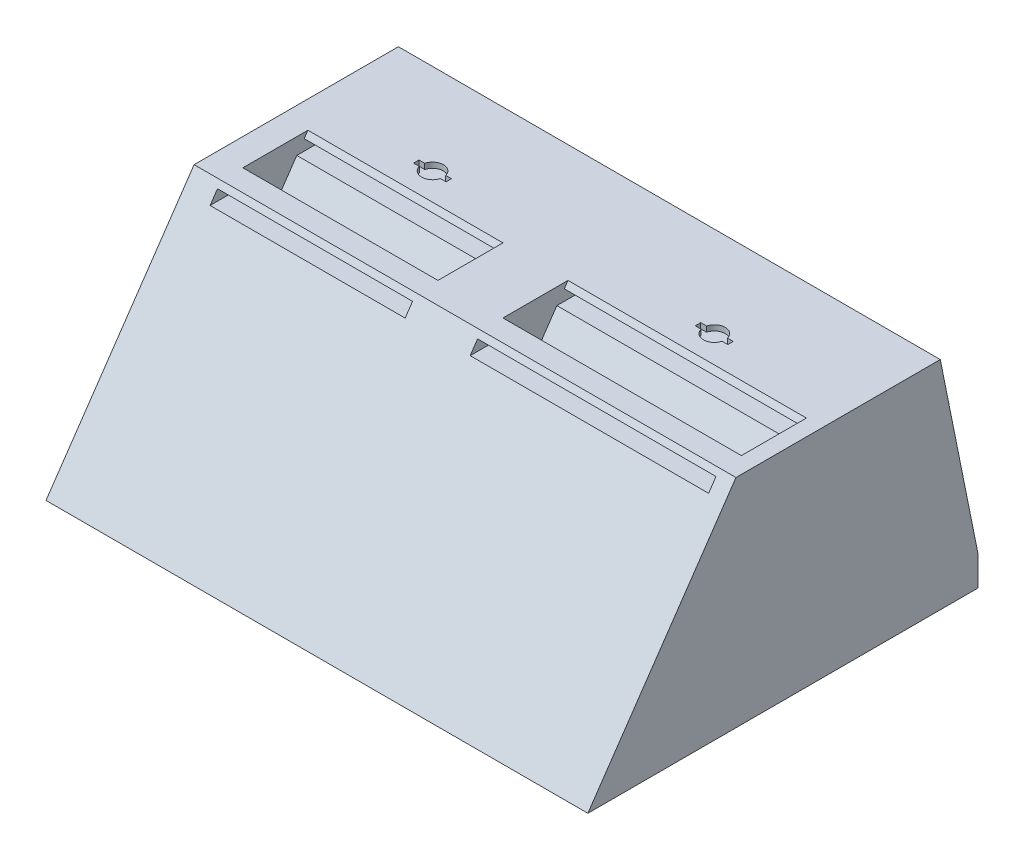
from build123d import *

# Parameters (mm, degrees)
SKIZZE1_W                            = 50
SKIZZE1_H                            = 30
AUFSATZ_LINEAR_AUSTRAGEN1_DEPTH      = 40
FPV_SENDER_START                     = -1.5
FPV_SENDER_DEPTH                     = 22
EMPF_NGER_START                      = 4.5
EMPF_NGER_DEPTH                      = 18
SCHNITT_LINEAR_AUSTRAGEN3_DEPTH      = 66.76473219
SCHNITT_LINEAR_AUSTRAGEN3_DEPTH_BACK = 66.76473219
SCHNITT_LINEAR_AUSTRAGEN5_REACH      = 65.411
WANDUNG2_START                       = -23
WANDUNG2_DEPTH                       = 46
WANDUNG2_START_2                     = -2.5
WANDUNG2_2_DEPTH                     = 2
SKIZZE6_W                            = 7
SKIZZE6_H                            = 6
SCHNITT_LINEAR_AUSTRAGEN4_DEPTH      = 2
SKIZZE8_W                            = 4
SKIZZE8_H                            = 6
SCHNITT_LINEAR_AUSTRAGEN7_DEPTH      = 2
SCHNITT_LINEAR_START                 = -2.5
SCHNITT_LINEAR_AUSTRAGEN8_DEPTH      = 18
SCHNITT_LINEAR_START_2               = -1.5
SCHNITT_LINEAR_AUSTRAGEN9_DEPTH      = 22
AUFSATZ_LINEAR_AUSTRAGEN2_REACH      = 63.847
SCHNITT_LINEAR_AUSTRAGEN10_REACH     = 50.177
SKIZZE11_R                           = 1
SKIZZE11_W                           = 3
SKIZZE11_H                           = 0.5


# Read off the part's stored shape, not the designer's step: Wandung2
with BuildPart() as part:
    # Skizze1 → Aufsatz-Linear austragen1 (new body)
    with BuildSketch(Plane.XY):
        Rectangle(SKIZZE1_W, SKIZZE1_H)
    extrude(amount=AUFSATZ_LINEAR_AUSTRAGEN1_DEPTH)

    # Skizze2 → FPV_Sender (cut)
    with BuildSketch(Plane.ZY.offset(FPV_SENDER_START)):
        Polygon((13.5, 15), (7.5, 15), (26.633333333, -13), (32.633333333, -13), align=None)
    extrude(amount=-FPV_SENDER_DEPTH, mode=Mode.SUBTRACT)

    # Skizze4 → Empfänger (cut)
    with BuildSketch(Plane.ZY.offset(EMPF_NGER_START)):
        Polygon((13.5, 15), (7.5, 15), (26.633333333, -13), (32.633333333, -13), align=None)
    extrude(amount=EMPF_NGER_DEPTH, mode=Mode.SUBTRACT)

    # Skizze5 → Schnitt-Linear austragen3 (cut, two sides: drawn at the far end of the back side and taken through both)
    with BuildSketch(Plane.ZY.offset(25).offset(-SCHNITT_LINEAR_AUSTRAGEN3_DEPTH_BACK)):
        Polygon((15.5, 15), (40, 15), (40, -20.853658537), align=None)
        Polygon((5.5, 15), (0, -12.25), (0, 15), align=None)
    extrude(amount=SCHNITT_LINEAR_AUSTRAGEN3_DEPTH + SCHNITT_LINEAR_AUSTRAGEN3_DEPTH_BACK, mode=Mode.SUBTRACT)

    # Schnitt-Linear austragen5: up to this face of the body (flat: up to its plane)
    schnitt_linear_austragen5_end = Plane(part.part.faces().sort_by_distance((-25, -2.83971717, 14.814249022))[0])
    # Skizze7 → Schnitt-Linear austragen5 (cut, up to the picked face)
    with BuildSketch(Plane(origin=(25, 0, 0), x_dir=(0, 0, -1), z_dir=(1, 0, 0)), mode=Mode.PRIVATE) as schnitt_linear_austragen5_sk1:
        Polygon((-5.5, 15), (-15.5, 15), (-22.333333333, 5), (-3.481651376, 5), align=None)
    schnitt_linear_austragen5_tool1 = split(extrude(schnitt_linear_austragen5_sk1.sketch, amount=-SCHNITT_LINEAR_AUSTRAGEN5_REACH, mode=Mode.PRIVATE), bisect_by=schnitt_linear_austragen5_end, keep=Keep.BOTH, mode=Mode.PRIVATE)
    add(schnitt_linear_austragen5_tool1.solids().sort_by(Axis((25, 9.488667, 11.826849), (-1, 0, 0)))[0], mode=Mode.SUBTRACT)

    # Wandung2 outline → Wandung2 (cut)
    with BuildSketch(Plane.YZ.offset(WANDUNG2_START)):
        Polygon((3, 13.27765036), (-15, 25.57765036), (-15, 2), (-12.449820142, 2), (3, 5.118312322), align=None)
    extrude(amount=WANDUNG2_DEPTH, mode=Mode.SUBTRACT)

    # Wandung2 2 outline → Wandung2 2 (cut)
    with BuildSketch(Plane.YZ.offset(WANDUNG2_START_2)):
        Polygon((-15, 33.57765036), (-15, 25.57765036), (3, 13.27765036), (3, 21.27765036), align=None)
    extrude(amount=WANDUNG2_2_DEPTH, mode=Mode.SUBTRACT)

    # Skizze6 → Schnitt-Linear austragen4 (cut)
    with BuildSketch(Plane(origin=(0, -13, 0), x_dir=(1, 0, 0), z_dir=(0, 1, 0))):
        with Locations((5, -29.633333333)):
            Rectangle(SKIZZE6_W, SKIZZE6_H)
    extrude(amount=-SCHNITT_LINEAR_AUSTRAGEN4_DEPTH, mode=Mode.SUBTRACT)

    # Skizze8 → Schnitt-Linear austragen7 (cut)
    with BuildSketch(Plane(origin=(0, -13, 0), x_dir=(1, 0, 0), z_dir=(0, 1, 0))):
        with Locations((-6.5, -29.633333333)):
            Rectangle(SKIZZE8_W, SKIZZE8_H)
    extrude(amount=-SCHNITT_LINEAR_AUSTRAGEN7_DEPTH, mode=Mode.SUBTRACT)

    # Skizze9 → Schnitt-Linear austragen8 (cut)
    with BuildSketch(Plane.ZY.offset(25).offset(SCHNITT_LINEAR_START)):
        Polygon((22.675, 4.5), (7.675, 4.5), (7.675, 3.5), (23.358333333, 3.5), align=None)
    extrude(amount=-SCHNITT_LINEAR_AUSTRAGEN8_DEPTH, mode=Mode.SUBTRACT)

    # Skizze10 → Schnitt-Linear austragen9 (cut)
    with BuildSketch(Plane(origin=(25, 0, 0), x_dir=(0, 0, -1), z_dir=(1, 0, 0)).offset(SCHNITT_LINEAR_START_2)):
        Polygon((-22.675, 4.5), (-7.675, 4.5), (-7.675, 3.5), (-23.358333333, 3.5), align=None)
    extrude(amount=-SCHNITT_LINEAR_AUSTRAGEN9_DEPTH, mode=Mode.SUBTRACT)

    # Aufsatz-Linear austragen2: up to this face of the body (flat: up to its plane)
    aufsatz_linear_austragen2_end = Plane(part.part.faces().sort_by_distance((23, -7.466953152, 11.743949806))[0])
    # Skizze12 → Aufsatz-Linear austragen2 (add, up to the picked face)
    with BuildSketch(Plane(origin=(-23, 0, 0), x_dir=(0, 0, -1), z_dir=(1, 0, 0)), mode=Mode.PRIVATE) as aufsatz_linear_austragen2_sk1:
        Polygon((-5.118312322, 3), (-13.27765036, 3), (-15.32765036, 0), (-4.512807735, 0), align=None)
    aufsatz_linear_austragen2_tool1 = split(extrude(aufsatz_linear_austragen2_sk1.sketch, amount=AUFSATZ_LINEAR_AUSTRAGEN2_REACH, mode=Mode.PRIVATE), bisect_by=aufsatz_linear_austragen2_end, keep=Keep.BOTH, mode=Mode.PRIVATE)
    add(aufsatz_linear_austragen2_tool1.solids().sort_by(Axis((-23, 1.430023, 9.575952), (1, 0, 0)))[0])

    # Schnitt-Linear austragen10: up to this face of the body (flat: up to its plane)
    schnitt_linear_austragen10_end = Plane(part.part.faces().sort_by_distance((0, 0, 9.920229048))[0])
    # Skizze11 → Schnitt-Linear austragen10 (cut, up to the picked face)
    with BuildSketch(Plane(origin=(0, 5, 0), x_dir=(1, 0, 0), z_dir=(0, 1, 0)), mode=Mode.PRIVATE) as schnitt_linear_austragen10_sk1:
        with Locations((12.5, -11.833333333)):
            Circle(SKIZZE11_R)
    schnitt_linear_austragen10_tool1 = split(extrude(schnitt_linear_austragen10_sk1.sketch, amount=-SCHNITT_LINEAR_AUSTRAGEN10_REACH, mode=Mode.PRIVATE), bisect_by=schnitt_linear_austragen10_end, keep=Keep.BOTH, mode=Mode.PRIVATE)
    # Skizze11 → Schnitt-Linear austragen10 (cut, up to the picked face)
    with BuildSketch(Plane(origin=(0, 5, 0), x_dir=(1, 0, 0), z_dir=(0, 1, 0)), mode=Mode.PRIVATE) as schnitt_linear_austragen10_sk2:
        with Locations((-13.5, -11.833333333)):
            Circle(SKIZZE11_R)
    schnitt_linear_austragen10_tool2 = split(extrude(schnitt_linear_austragen10_sk2.sketch, amount=-SCHNITT_LINEAR_AUSTRAGEN10_REACH, mode=Mode.PRIVATE), bisect_by=schnitt_linear_austragen10_end, keep=Keep.BOTH, mode=Mode.PRIVATE)
    # Skizze11 → Schnitt-Linear austragen10 (cut, up to the picked face)
    with BuildSketch(Plane(origin=(0, 5, 0), x_dir=(1, 0, 0), z_dir=(0, 1, 0)), mode=Mode.PRIVATE) as schnitt_linear_austragen10_sk3:
        with Locations((12.5, -11.833333333)):
            Rectangle(SKIZZE11_W, SKIZZE11_H)
    schnitt_linear_austragen10_tool3 = split(extrude(schnitt_linear_austragen10_sk3.sketch, amount=-SCHNITT_LINEAR_AUSTRAGEN10_REACH, mode=Mode.PRIVATE), bisect_by=schnitt_linear_austragen10_end, keep=Keep.BOTH, mode=Mode.PRIVATE)
    # Skizze11 → Schnitt-Linear austragen10 (cut, up to the picked face)
    with BuildSketch(Plane(origin=(0, 5, 0), x_dir=(1, 0, 0), z_dir=(0, 1, 0)), mode=Mode.PRIVATE) as schnitt_linear_austragen10_sk4:
        with Locations((-13.5, -11.833333333)):
            Rectangle(SKIZZE11_W, SKIZZE11_H)
    schnitt_linear_austragen10_tool4 = split(extrude(schnitt_linear_austragen10_sk4.sketch, amount=-SCHNITT_LINEAR_AUSTRAGEN10_REACH, mode=Mode.PRIVATE), bisect_by=schnitt_linear_austragen10_end, keep=Keep.BOTH, mode=Mode.PRIVATE)
    add(schnitt_linear_austragen10_tool1.solids().sort_by(Axis((12.5, 5, 11.833333), (0, -1, 0)))[0], mode=Mode.SUBTRACT)
    add(schnitt_linear_austragen10_tool2.solids().sort_by(Axis((-13.5, 5, 11.833333), (0, -1, 0)))[0], mode=Mode.SUBTRACT)
    add(schnitt_linear_austragen10_tool3.solids().sort_by(Axis((12.5, 5, 11.833333), (0, -1, 0)))[0], mode=Mode.SUBTRACT)
    add(schnitt_linear_austragen10_tool4.solids().sort_by(Axis((-13.5, 5, 11.833333), (0, -1, 0)))[0], mode=Mode.SUBTRACT)


solid = part.part
